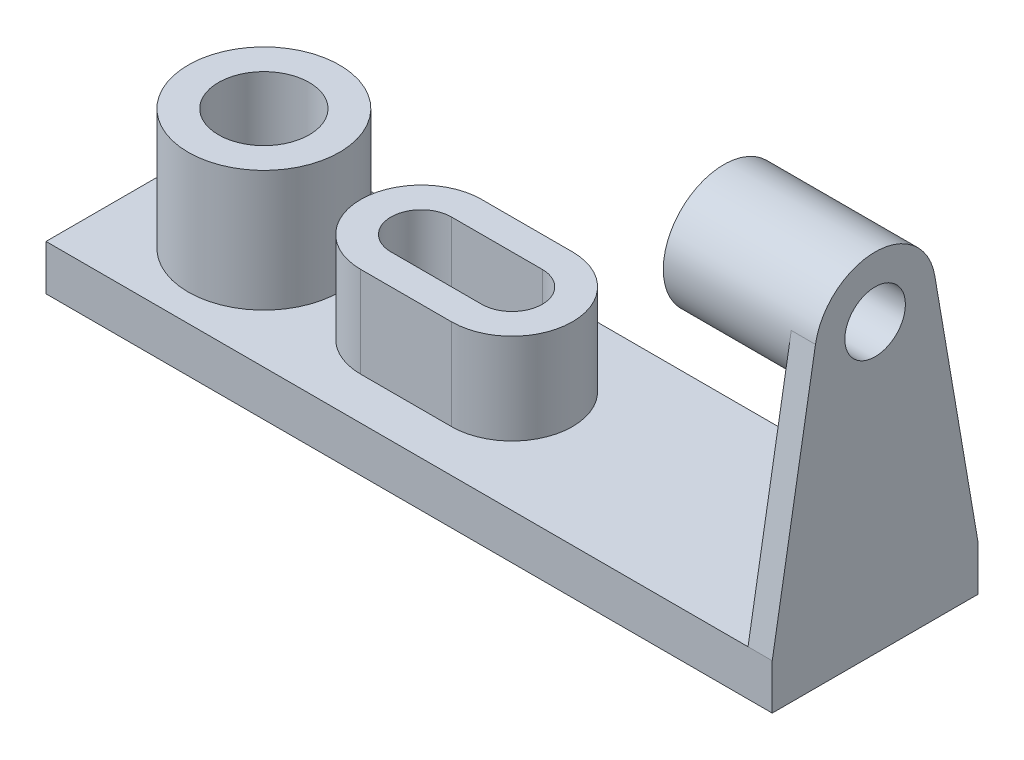
from build123d import *
from build123d.topology import SkipClean

# Parameters (mm, degrees)
SKETCH2_W               = 240
SKETCH2_H               = 68
SKETCH2_R               = 25
BOSS_EXTRUDE1_DEPTH     = 15
SKETCH2_4_R             = 25
BOSS_EXTRUDE3_DEPTH     = 40
SKETCH2_5_R             = 15
CUT_EXTRUDE1_DEPTH      = 52
BOSS_EXTRUDE6_DEPTH     = 30
CUT_EXTRUDE3_DEPTH      = 30
CUT_EXTRUDE3_DEPTH_BACK = 30
SKETCH9_R               = 10
BOSS_EXTRUDE7_DEPTH     = 8
SKETCH10_R              = 20
SKETCH10_R_2            = 10
BOSS_EXTRUDE8_DEPTH     = 42


with BuildPart() as part:
    # Sketch2 → Boss-Extrude1 (new body)
    with BuildSketch(Plane(origin=(0, 0, 0), x_dir=(1, 0, 0), z_dir=(0, 1, 0))):
        Rectangle(SKETCH2_W, SKETCH2_H)
        with Locations((-82, 0)):
            Circle(SKETCH2_R, mode=Mode.SUBTRACT)
    extrude(amount=-BOSS_EXTRUDE1_DEPTH)

    # Sketch4 → Boss-Extrude6 (add)
    with BuildSketch(Plane(origin=(0, 0, 0), x_dir=(1, 0, 0), z_dir=(0, 1, 0))):
        with BuildLine():
            Line((-30, 20), (0, 20))
            ThreePointArc((0, 20), (20, 0), (0, -20))
            Line((0, -20), (-30, -20))
            ThreePointArc((-30, -20), (-50, 0), (-30, 20))
        make_face()
        with BuildLine():
            Line((-30, 10), (0, 10))
            ThreePointArc((0, 10), (10, 0), (0, -10))
            Line((0, -10), (-30, -10))
            ThreePointArc((-30, -10), (-40, 0), (-30, 10))
        make_face(mode=Mode.SUBTRACT)
    extrude(amount=BOSS_EXTRUDE6_DEPTH)

    # Sketch6 → Cut-Extrude3 (cut, two sides: drawn at the far end of the back side and taken through both)
    with SkipClean():  # the faces are left unmerged after this step: merging them gives an invalid solid
        with BuildSketch(Plane(origin=(0, 0, 0), x_dir=(1, 0, 0), z_dir=(0, 1, 0)).offset(-CUT_EXTRUDE3_DEPTH_BACK)):
            with BuildLine():
                Line((-30, -10), (0, -10))
                ThreePointArc((0, -10), (10, 0), (0, 10))
                Line((0, 10), (-30, 10))
                ThreePointArc((-30, 10), (-40, 0), (-30, -10))
            make_face()
        extrude(amount=CUT_EXTRUDE3_DEPTH + CUT_EXTRUDE3_DEPTH_BACK, mode=Mode.SUBTRACT)
    add(part.part.scale(1), mode=Mode.REPLACE)  # the faces are merged on a copy

    # Sketch9 → Boss-Extrude7 (add)
    with BuildSketch(Plane(origin=(120, 0, 0), x_dir=(0, 0, -1), z_dir=(1, 0, 0))):
        with BuildLine():
            Line((-34, 0), (-19.712682674, 83.377890137))
            ThreePointArc((-19.712682674, 83.377890137), (0.076073465, 99.99985532), (19.737808866, 83.227832272))
            Line((19.737808866, 83.227832272), (34, 0))
            Line((34, 0), (-34, 0))
        make_face()
        with Locations((0, 80)):
            Circle(SKETCH9_R, mode=Mode.SUBTRACT)
    extrude(amount=-BOSS_EXTRUDE7_DEPTH)

    # Sketch10 → Boss-Extrude8 (add)
    with SkipClean():  # the faces are left unmerged after this step: merging them gives an invalid solid
        with BuildSketch(Plane.ZY.offset(-112)):
            with Locations((0, 80)):
                Circle(SKETCH10_R)
            with Locations((0, 80)):
                Circle(SKETCH10_R_2, mode=Mode.SUBTRACT)
        extrude(amount=BOSS_EXTRUDE8_DEPTH)
    add(part.part.scale(1), mode=Mode.REPLACE)  # the faces are merged on a copy


with BuildPart() as body_2:
    # Sketch2<4> → Boss-Extrude3 (new body)
    with BuildSketch(Plane(origin=(0, 0, 0), x_dir=(1, 0, 0), z_dir=(0, 1, 0))):
        with Locations((-82, 0)):
            Circle(SKETCH2_4_R)
    extrude(amount=BOSS_EXTRUDE3_DEPTH)

    # Sketch2<5> → Cut-Extrude1 (cut)
    with BuildSketch(Plane(origin=(0, 0, 0), x_dir=(1, 0, 0), z_dir=(0, 1, 0))):
        with Locations((-82, 0)):
            Circle(SKETCH2_5_R)
    extrude(amount=CUT_EXTRUDE1_DEPTH, mode=Mode.SUBTRACT)


solid = Compound([part.part, body_2.part])
